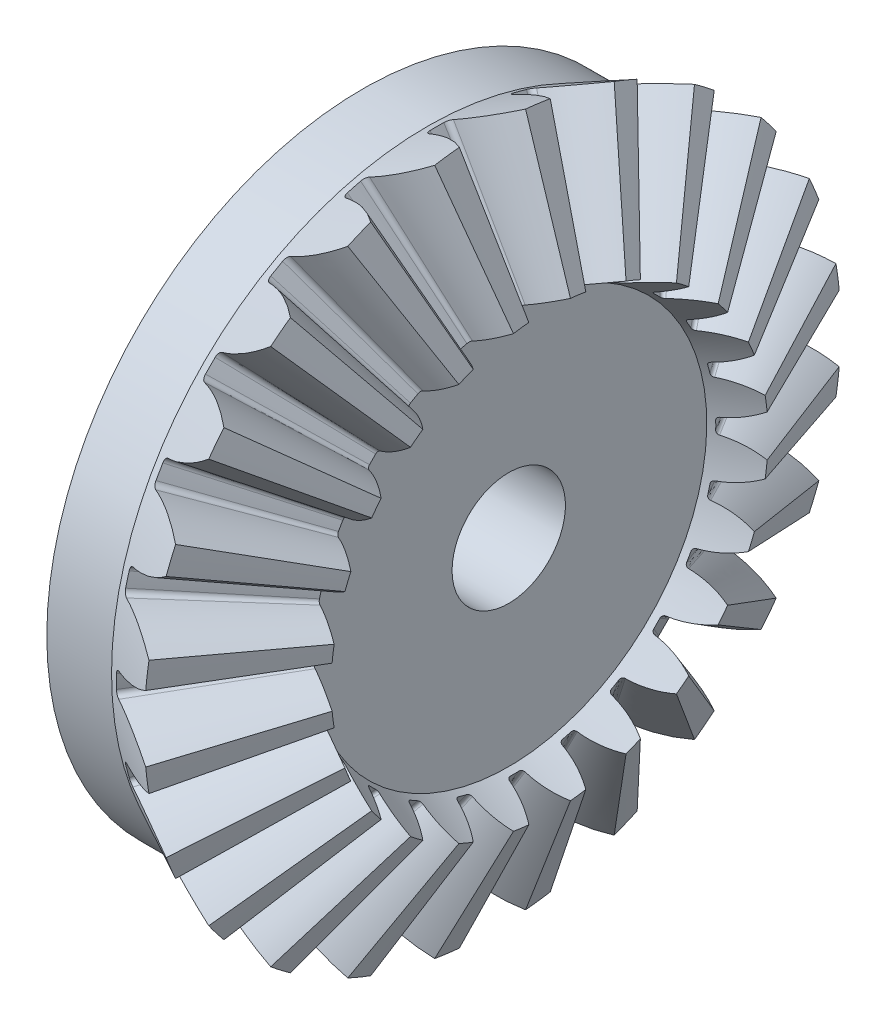
from build123d import *

# Parameters (mm, degrees)
TEETHCUTS_COUNT = 24
TEETHCUTS_ANGLE = 345
HUBSKE_R        = 11.142467931
HUB_DEPTH       = 2.285037461
BORSKE_R        = 2
BORE_DEPTH      = 10.0000508


with BuildPart() as part:
    # BasProSke → Base-Revolve (revolve)
    with BuildSketch(Plane(origin=(0, 0, 0), x_dir=(1, 0, 0), z_dir=(0, 1, 0)), mode=Mode.PRIVATE) as base_revolve_sk:
        Polygon((0, 0), (0, 11.142467933), (2.30091395, 12.292924904), (4.318648589, 7.71162228), (2.875234639, 6.989915308), (2.875234639, 0), align=None)
    revolve(base_revolve_sk.sketch.rotate(Axis((-10, 0, 0), (1, 0, 0)), 180), axis=Axis((-10, 0, 0), (1, 0, 0)))

    # ToothCut: read off the stored shape, not the designer's step
    # ToothCut: loft between two sections, ruled curve by curve
    toothcut_from = [
        Edge.make_bspline([(7.723651839, 0.004293849, -0.008312879), (7.718187749, 0.001561805, -0.015368804), (7.709864822, -0.002599659, -0.014649419), (7.705435657, -0.004814241, -0.00673838)], [0, 0, 0, 0, 1, 1, 1, 1], 3, [1, 0.729558285, 0.729558285, 1]),
        Edge.make_bspline([(7.705435657, -0.004814241, 0.00673838), (7.709864822, -0.002599659, 0.014649419), (7.718187749, 0.001561805, 0.015368804), (7.723651839, 0.004293849, 0.008312879)], [0, 0, 0, 0, 1, 1, 1, 1], 3, [1, 0.729558285, 0.729558285, 1]),
        Edge.make_bspline([(7.705435657, -0.004814241, -0.00673838), (7.704861752, -0.005101194, -0.005713314), (7.704423725, -0.005320207, -0.004607585), (7.704130438, -0.005466851, -0.003443562)], [0, 0, 0, 0, 1, 1, 1, 1], 3, [1, 0.9932568, 0.9932568, 1]),
        Edge.make_bspline([(7.704130438, -0.005466851, 0.003443562), (7.704423725, -0.005320207, 0.004607585), (7.704861752, -0.005101194, 0.005713314), (7.705435657, -0.004814241, 0.00673838)], [0, 0, 0, 0, 1, 1, 1, 1], 3, [1, 0.9932568, 0.9932568, 1]),
        Edge.make_bspline([(7.704130438, -0.005466851, -0.003443562), (7.70355942, -0.00575236, -0.001177256), (7.70355942, -0.00575236, 0.001177256), (7.704130438, -0.005466851, 0.003443562)], [0, 0, 0, 0, 1, 1, 1, 1], 3, [1, 0.975025372, 0.975025372, 1]),
        Edge.make_line((7.723651839, 0.004293849, 0.008312879), (7.723651839, 0.004293849, -0.008312879)),
    ]
    toothcut_to = [
        Edge.make_bspline([(2.467042523, 12.375989191, -1.317007542), (1.881121431, 12.083028645, -0.838483932), (1.207297185, 11.746116524, -0.537543138), (0.487747509, 11.386341686, -0.433022409)], [0, 0, 0, 0, 1, 1, 1, 1], 3, [1, 0.979135152, 0.979135152, 1]),
        Edge.make_bspline([(0.487747509, 11.386341686, 0.433022409), (1.207297185, 11.746116524, 0.537543138), (1.881121431, 12.083028645, 0.838483932), (2.467042523, 12.375989191, 1.317007542)], [0, 0, 0, 0, 1, 1, 1, 1], 3, [1, 0.979135152, 0.979135152, 1]),
        Edge.make_bspline([(0.487747509, 11.386341686, -0.433022409), (0.397621574, 11.341278719, -0.419930849), (0.338430856, 11.31168336, -0.342824961), (0.340525718, 11.312730791, -0.241241209)], [0, 0, 0, 0, 1, 1, 1, 1], 3, [1, 0.829081524, 0.829081524, 1]),
        Edge.make_bspline([(0.340525718, 11.312730791, 0.241241209), (0.338430856, 11.31168336, 0.342824961), (0.397621574, 11.341278719, 0.419930849), (0.487747509, 11.386341686, 0.433022409)], [0, 0, 0, 0, 1, 1, 1, 1], 3, [1, 0.829081524, 0.829081524, 1]),
        Edge.make_bspline([(0.340525718, 11.312730791, -0.241241209), (0.343842011, 11.314388938, -0.080427982), (0.343842011, 11.314388938, 0.080427982), (0.340525718, 11.312730791, 0.241241209)], [0, 0, 0, 0, 1, 1, 1, 1], 3, [1, 0.999822876, 0.999822876, 1]),
        Edge.make_line((2.467042523, 12.375989191, 1.317007542), (2.467042523, 12.375989191, -1.317007542)),
    ]
    toothcut = Solid(Shell([*[Face.make_surface_from_curves(toothcut_from[k], toothcut_to[k]) for k in range(6)], Face(Wire(toothcut_from)), Face(Wire(toothcut_to))]))
    add(toothcut, mode=Mode.SUBTRACT)

    # TeethCuts: ToothCut ×24 about axis
    teethcuts_axis = Axis((-10, 0, 0), (1, 0, 0))
    for i in range(1, TEETHCUTS_COUNT):
        add(toothcut.rotate(teethcuts_axis, i * TEETHCUTS_ANGLE / (TEETHCUTS_COUNT - 1)), mode=Mode.SUBTRACT)

    # HubSke → Hub (add)
    with BuildSketch(Plane.ZY):
        Circle(HUBSKE_R)
    extrude(amount=HUB_DEPTH)

    # BorSke → Bore (cut, symmetric)
    with BuildSketch(Plane(origin=(0, 0, 0), x_dir=(0, 0, -1), z_dir=(1, 0, 0))):
        with Locations(Location((0, 0, 0), (0, 0, 180))):
            Circle(BORSKE_R)
    extrude(amount=BORE_DEPTH, both=True, mode=Mode.SUBTRACT)


solid = part.part
